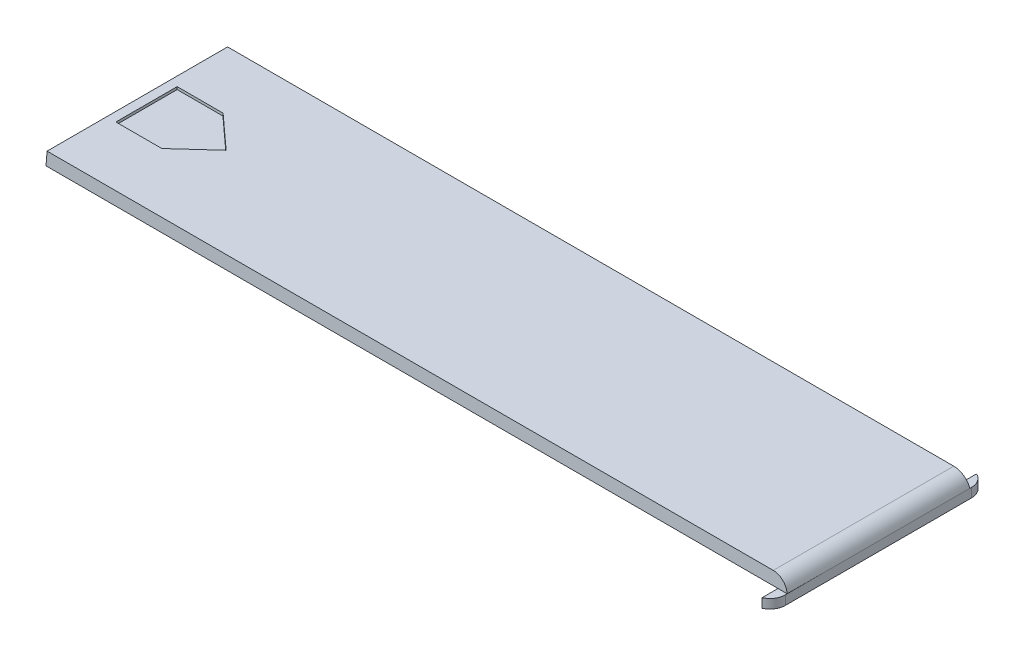
from build123d import *

# Parameters (mm, degrees)
SKETCH2_W           = 121
SKETCH2_H           = 29.819553929
BASE_EXTRUDE_DEPTH  = 2
DRAFT1_ANGLE        = 5
FILLET3_R           = 2.5
BOSS_EXTRUDE1_DEPTH = 1.5
BOSS_EXTRUDE2_DEPTH = 2
CUT_EXTRUDE3_DEPTH  = 0.4
CUT_EXTRUDE3_TAPER  = 3


with BuildPart() as part:
    # Sketch2 → Base-Extrude (new body)
    with BuildSketch(Plane(origin=(0, 0, 0), x_dir=(1, 0, 0), z_dir=(0, 1, 0))):
        with Locations((-60.5, 14.909776965)):
            Rectangle(SKETCH2_W, SKETCH2_H)
    extrude(amount=BASE_EXTRUDE_DEPTH)

    # Draft1
    draft1_faces = [part.faces().sort_by_distance(p)[0] for p in [
        (-60.5, 1, 0),
        (-60.5, 1, -29.819553929),
    ]]
    draft(draft1_faces, Plane.ZX, DRAFT1_ANGLE)

    # Fillet3
    # the kernel refuses this fillet: 2.5 mm, written as the material it takes off along each edge
    with BuildSketch(Plane(origin=(0, 2, 5.94874703), x_dir=(-1.5669991185737358e-12, -1.0, 0), z_dir=(0, 0, -1))) as fillet3_piece_1:
        with BuildLine():
            CenterArc((2.5, 2.449489743), FILLET3_R, 180, 78.463040967)
            Line((0, 2.449489743), (-0.05, 2.449489743))
            Line((-0.05, 2.449489743), (-0.05, 0))
            Line((-0.05, 0), (0, -0.05))
            ThreePointArc((0, -0.05), (1, -0.05), (1.99, -0.048989795))
            Line((1.99, -0.048989795), (2, 0))
        make_face()
    extrude(amount=41.717047988, mode=Mode.SUBTRACT)

    # Sketch3 → Boss-Extrude1 (add)
    with BuildSketch(Plane.XZ):
        with BuildLine():
            Line((0, 0.298935188), (0, -30.118489117))
            ThreePointArc((0, -30.118489117), (-0.408349934, -31.487795511), (-1.5, -32.409776964))
            Line((-1.5, -32.409776964), (-1.5, 2.590223036))
            ThreePointArc((-1.5, 2.590223036), (-0.408349934, 1.668241582), (0, 0.298935188))
        make_face()
    extrude(amount=BOSS_EXTRUDE1_DEPTH)

    # Sketch4 → Boss-Extrude2 (add)
    with BuildSketch(Plane.XZ):
        with BuildLine():
            Line((-120.25, -18.469776964), (-121.75, -18.469776964))
            ThreePointArc((-121.75, -18.469776964), (-122.633883476, -18.103660441), (-123, -17.219776964))
            Line((-123, -17.219776964), (-123, -12.599776964))
            ThreePointArc((-123, -12.599776964), (-122.633883476, -11.715893488), (-121.75, -11.349776964))
            Line((-121.75, -11.349776964), (-120.25, -11.349776964))
            ThreePointArc((-120.25, -11.349776964), (-119.366116524, -11.715893488), (-119, -12.599776964))
            Line((-119, -12.599776964), (-119, -17.219776964))
            ThreePointArc((-119, -17.219776964), (-119.366116524, -18.103660441), (-120.25, -18.469776964))
        make_face()
    extrude(amount=BOSS_EXTRUDE2_DEPTH)

    # Sketch5 → Cut-Extrude3 (cut)
    with BuildSketch(Plane(origin=(-217.927600689, 2, 0), x_dir=(1, 0, 0), z_dir=(0, -1, 0))):
        Polygon((105.927600689, -19.909776964), (111.427600689, -14.909776964), (105.927600689, -9.909776964), (98.427600689, -9.909776964), (98.427600689, -19.909776964), align=None)
    extrude(amount=CUT_EXTRUDE3_DEPTH, taper=CUT_EXTRUDE3_TAPER, mode=Mode.SUBTRACT)


solid = part.part
